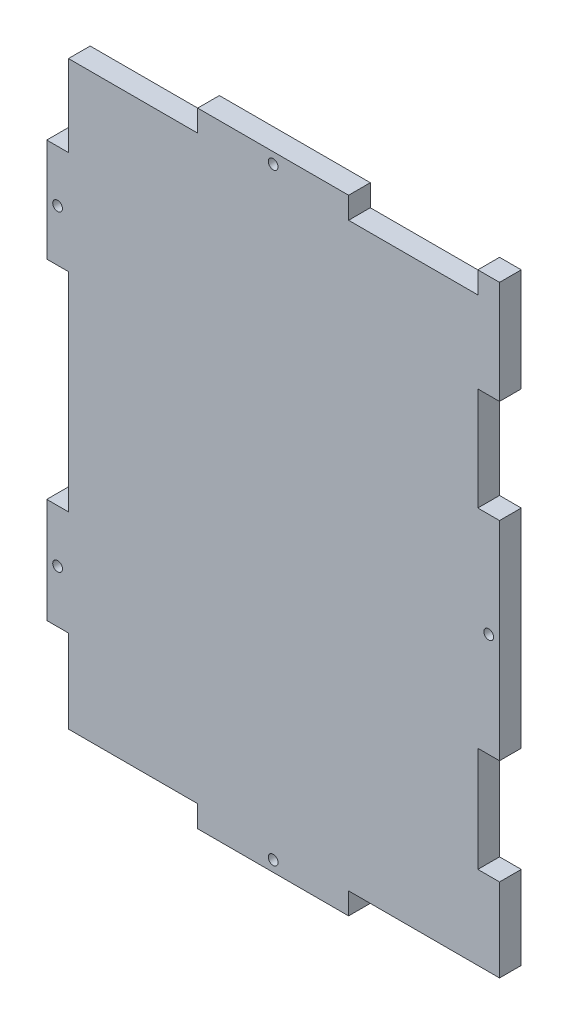
from build123d import *

# Parameters (mm, degrees)
SKETCH1_W             = 120.8024
SKETCH1_H             = 166.5224
BOSS_EXTRUDE1_DEPTH   = 5.7912
SKETCH7_R             = 1.30175
CUT_EXTRUDE6_DEPTH    = 104.025581213
SKETCH9_W             = 5.7912
SKETCH9_H             = 27.9908
CUT_EXTRUDE7_DEPTH    = 104.025581213
SKETCH10_W            = 5.7912
SKETCH10_H            = 27.516666666
CUT_EXTRUDE8_DEPTH    = 104.025581213
SKETCH11_R            = 1.30175
CUT_EXTRUDE9_DEPTH    = 104.025581213
SKETCH12_R            = 1.30175
CUT_EXTRUDE10_DEPTH   = 104.025581213
CAVITY2_START         = -83.2612
CAVITY2_OUTLINE_W     = 40.267466667
CAVITY2_OUTLINE_H     = 5.7912
CAVITY2_DEPTH         = 5.7912
CAVITY2_START_2       = 77.47
CAVITY2_2_OUTLINE_W   = 40.267466667
CAVITY2_2_OUTLINE_H   = 5.7912
CAVITY2_2_OUTLINE_W_2 = 34.476266667
CAVITY2_2_DEPTH       = 5.7912
CAVITY2_START_3       = -27.2796
CAVITY2_3_OUTLINE_W   = 5.7912
CAVITY2_3_OUTLINE_H   = 5.7912
CAVITY2_3_DEPTH       = 55.507466667
CAVITY2_START_4       = -77.47
CAVITY2_4_OUTLINE_W   = 5.7912
CAVITY2_4_OUTLINE_H   = 5.7912
CAVITY2_4_DEPTH       = 22.1996
CAVITY2_START_5       = 55.744533333
CAVITY2_5_OUTLINE_W   = 5.7912
CAVITY2_5_OUTLINE_H   = 5.7912
CAVITY2_5_DEPTH       = 21.725466667


# Read off the part's stored shape, not the designer's step: Cavity2
with BuildPart() as part:
    # Sketch1 → Boss-Extrude1 (new body)
    with BuildSketch(Plane.XY):
        Rectangle(SKETCH1_W, SKETCH1_H)
    extrude(amount=BOSS_EXTRUDE1_DEPTH)

    # Sketch7 → Cut-Extrude6 (cut, through all)
    with BuildSketch(Plane.XY.offset(5.7912)):
        with Locations((-57.5056, -41.275)):
            Circle(SKETCH7_R)
        with Locations((-57.5056, 41.9862)):
            Circle(SKETCH7_R)
        with Locations(Location((58.473654732, -41.275, 0), (0, 0, 180))):
            Circle(SKETCH7_R)
        with Locations(Location((58.473654732, 41.9862, 0), (0, 0, 180))):
            Circle(SKETCH7_R)
    extrude(amount=-CUT_EXTRUDE6_DEPTH, mode=Mode.SUBTRACT)

    # Sketch9 → Cut-Extrude7 (cut, through all)
    with BuildSketch(Plane.XY.offset(5.7912)):
        with Locations((57.5056, -41.275)):
            Rectangle(SKETCH9_W, SKETCH9_H)
    extrude(amount=-CUT_EXTRUDE7_DEPTH, mode=Mode.SUBTRACT)

    # Sketch10 → Cut-Extrude8 (cut, through all)
    with BuildSketch(Plane.XY.offset(5.7912)):
        with Locations((57.5056, 41.9862)):
            Rectangle(SKETCH10_W, SKETCH10_H)
    extrude(amount=-CUT_EXTRUDE8_DEPTH, mode=Mode.SUBTRACT)

    # Sketch11 → Cut-Extrude9 (cut, through all)
    with BuildSketch(Plane.XY.offset(5.7912)):
        with Locations((57.5056, 0.474133333)):
            Circle(SKETCH11_R)
    extrude(amount=-CUT_EXTRUDE9_DEPTH, mode=Mode.SUBTRACT)

    # Sketch12 → Cut-Extrude10 (cut, through all)
    with BuildSketch(Plane.XY.offset(5.7912)):
        with Locations((0, 80.3656)):
            Circle(SKETCH12_R)
        with Locations((0, -80.3656)):
            Circle(SKETCH12_R)
    extrude(amount=-CUT_EXTRUDE10_DEPTH, mode=Mode.SUBTRACT)

    # Cavity2 outline → Cavity2 (cut)
    with BuildSketch(Plane(origin=(0, 0, 0), x_dir=(1, 0, 0), z_dir=(0, 1, 0)).offset(CAVITY2_START)):
        with Locations((-40.267466666, -2.8956)):
            Rectangle(CAVITY2_OUTLINE_W, CAVITY2_OUTLINE_H)
        with Locations((40.267466666, -2.8956)):
            Rectangle(CAVITY2_OUTLINE_W, CAVITY2_OUTLINE_H)
    extrude(amount=CAVITY2_DEPTH, mode=Mode.SUBTRACT)

    # Cavity2 2 outline → Cavity2 2 (cut)
    with BuildSketch(Plane(origin=(0, 0, 0), x_dir=(1, 0, 0), z_dir=(0, 1, 0)).offset(CAVITY2_START_2)):
        with Locations((-40.267466666, -2.8956)):
            Rectangle(CAVITY2_2_OUTLINE_W, CAVITY2_2_OUTLINE_H)
        with Locations((37.371866667, -2.8956)):
            Rectangle(CAVITY2_2_OUTLINE_W_2, CAVITY2_2_OUTLINE_H)
    extrude(amount=CAVITY2_2_DEPTH, mode=Mode.SUBTRACT)

    # Cavity2 3 outline → Cavity2 3 (cut)
    with BuildSketch(Plane(origin=(0, 0, 0), x_dir=(1, 0, 0), z_dir=(0, 1, 0)).offset(CAVITY2_START_3)):
        with Locations((-57.5056, -2.8956)):
            Rectangle(CAVITY2_3_OUTLINE_W, CAVITY2_3_OUTLINE_H)
    extrude(amount=CAVITY2_3_DEPTH, mode=Mode.SUBTRACT)

    # Cavity2 4 outline → Cavity2 4 (cut)
    with BuildSketch(Plane(origin=(0, 0, 0), x_dir=(1, 0, 0), z_dir=(0, 1, 0)).offset(CAVITY2_START_4)):
        with Locations((-57.5056, -2.8956)):
            Rectangle(CAVITY2_4_OUTLINE_W, CAVITY2_4_OUTLINE_H)
    extrude(amount=CAVITY2_4_DEPTH, mode=Mode.SUBTRACT)

    # Cavity2 5 outline → Cavity2 5 (cut)
    with BuildSketch(Plane(origin=(0, 0, 0), x_dir=(1, 0, 0), z_dir=(0, 1, 0)).offset(CAVITY2_START_5)):
        with Locations((-57.5056, -2.8956)):
            Rectangle(CAVITY2_5_OUTLINE_W, CAVITY2_5_OUTLINE_H)
    extrude(amount=CAVITY2_5_DEPTH, mode=Mode.SUBTRACT)


solid = part.part
